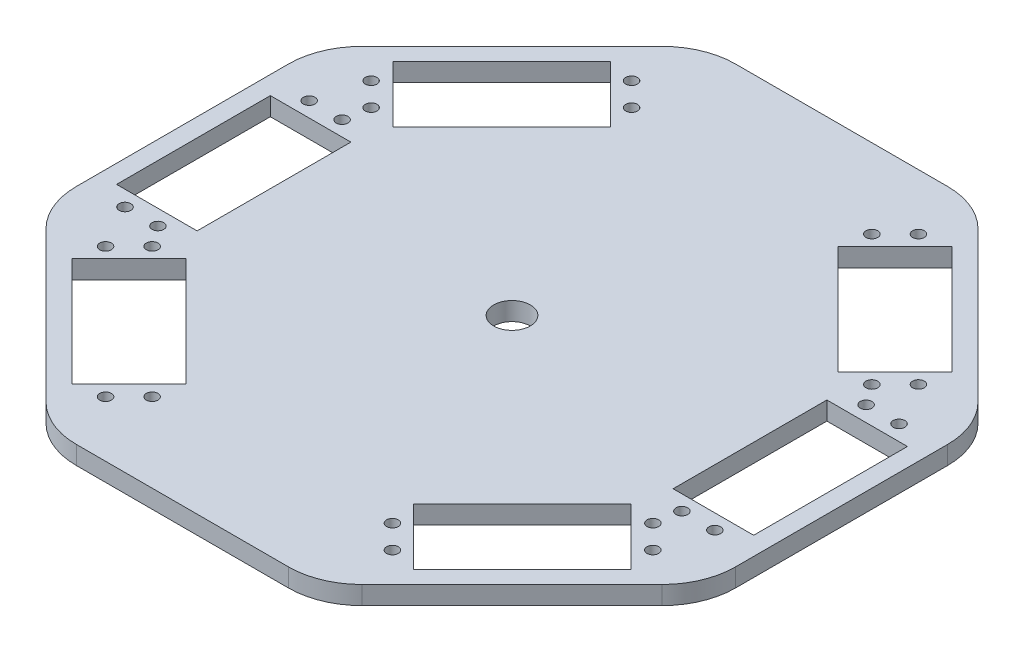
from build123d import *

# Parameters (mm, degrees)
BOSS_EXTRUDE1_DEPTH = 5
FILLET1_R           = 20
SKETCH2_W           = 22
SKETCH2_H           = 42
SKETCH2_R           = 1.6
CUT_EXTRUDE1_DEPTH  = 128.377392029
SKETCH3_R           = 5
CUT_EXTRUDE2_DEPTH  = 128.377392029
CIRPATTERN1_COUNT   = 8


with BuildPart() as part:
    # Sketch1 → Boss-Extrude1 (new body)
    with BuildSketch(Plane(origin=(0, 0, 0), x_dir=(1, 0, 0), z_dir=(0, 1, 0))):
        Polygon((-90, 37.279220614), (-90, -37.279220614), (-37.279220614, -90), (37.279220614, -90), (90, -37.279220614), (90, 37.279220614), (37.279220614, 90), (-37.279220614, 90), align=None)
    extrude(amount=BOSS_EXTRUDE1_DEPTH)

    # Fillet1
    fillet1_edges = [part.edges().sort_by_distance(p)[0] for p in [
        (-90, 2.5, -37.279220614),
        (-37.279220614, 2.5, -90),
        (37.279220614, 2.5, -90),
        (90, 2.5, -37.279220614),
        (90, 2.5, 37.279220614),
        (37.279220614, 2.5, 90),
        (-37.279220614, 2.5, 90),
        (-90, 2.5, 37.279220614),
    ]]
    fillet(fillet1_edges, radius=FILLET1_R)

    # Sketch2 → Cut-Extrude1 (cut, through all)
    with BuildSketch(Plane(origin=(0, 5, 0), x_dir=(1, 0, 0), z_dir=(0, 1, 0))):
        with Locations((74, 2.005050634)):
            Rectangle(SKETCH2_W, SKETCH2_H)
        with Locations((78.5, 27.205050634)):
            Circle(SKETCH2_R)
        with Locations((69.5, 27.205050634)):
            Circle(SKETCH2_R)
        with Locations((69.5, -23.094949366)):
            Circle(SKETCH2_R)
        with Locations((78.5, -23.094949366)):
            Circle(SKETCH2_R)
    cut_extrude1 = extrude(amount=-CUT_EXTRUDE1_DEPTH, mode=Mode.SUBTRACT)

    # Sketch3 → Cut-Extrude2 (cut, through all)
    with BuildSketch(Plane(origin=(0, 5, 0), x_dir=(1, 0, 0), z_dir=(0, 1, 0))):
        Circle(SKETCH3_R)
    extrude(amount=-CUT_EXTRUDE2_DEPTH, mode=Mode.SUBTRACT)

    # CirPattern1: Cut-Extrude1 ×8 about axis, 2 skipped
    cirpattern1_axis = Axis((0, 5, 0), (0, 1, 0))
    add([cut_extrude1.rotate(cirpattern1_axis, i * 360 / CIRPATTERN1_COUNT) for i in range(1, CIRPATTERN1_COUNT) if i not in (2, 6)], mode=Mode.SUBTRACT)


solid = part.part
